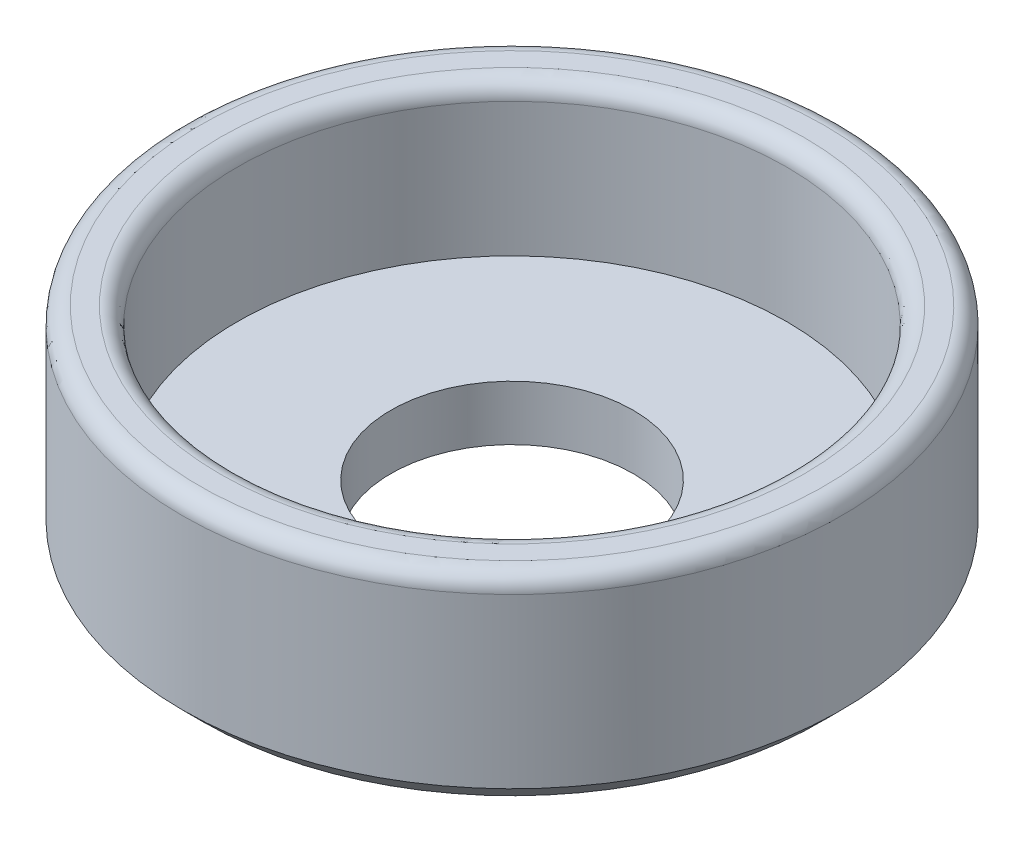
from build123d import *

# Parameters (mm, degrees)
SKETCH2_R          = 1.765
CUT_EXTRUDE1_DEPTH = 8.13582511
FILLET1_R          = 0.25
CHAMFER1_SIZE      = 0.3


with BuildPart() as part:
    # Sketch1 → Revolve1 (revolve)
    with BuildSketch(Plane.XY):
        Polygon((0, 0), (4.8, 0), (4.8, 3), (4, 3), (4, 0.8), (0, 0.8), align=None)
    revolve(axis=Axis((0, 0.8, 0), (0, -1, 0)))

    # Sketch2 → Cut-Extrude1 (cut, through all)
    with BuildSketch(Plane(origin=(0, 0.8, 0), x_dir=(1, 0, 0), z_dir=(0, 1, 0))):
        Circle(SKETCH2_R)
    extrude(amount=-CUT_EXTRUDE1_DEPTH, mode=Mode.SUBTRACT)

    # Fillet1
    fillet1_edges = [part.edges().sort_by_distance(p)[0] for p in [
        (-4, 3, 0),
        (-4.8, 3, 0),
    ]]
    fillet(fillet1_edges, radius=FILLET1_R)

    # Chamfer1
    chamfer1_edges = [part.edges().sort_by_distance(p)[0] for p in [
        (-4.8, 0, 0),
    ]]
    chamfer(chamfer1_edges, length=CHAMFER1_SIZE)


solid = part.part
